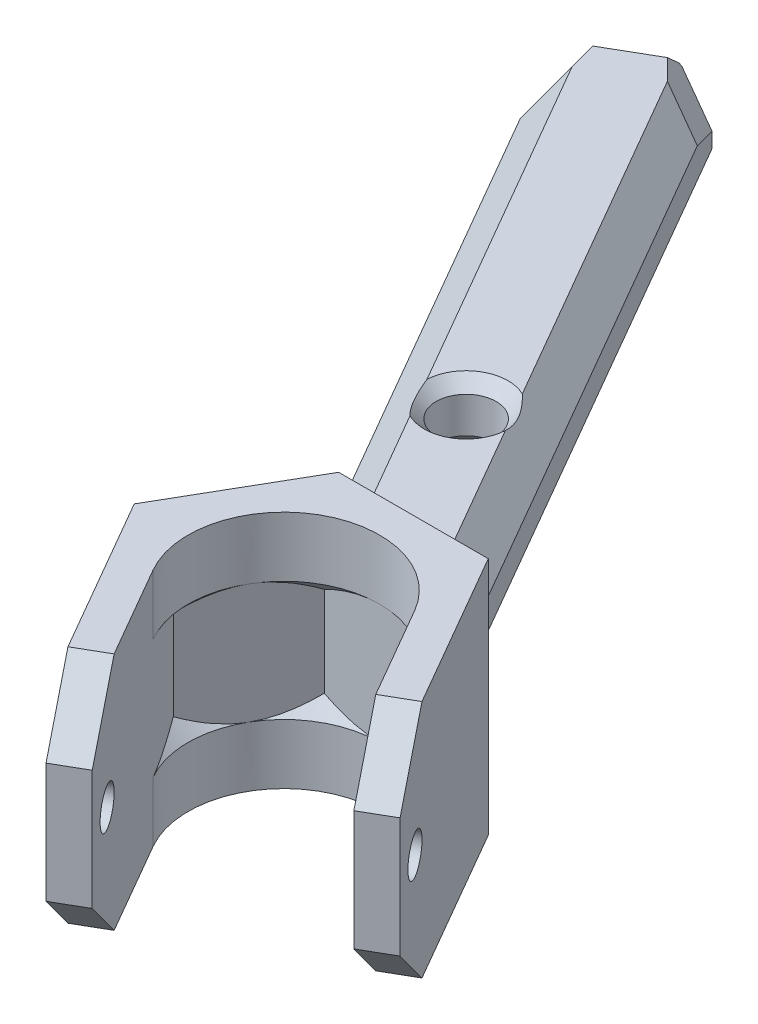
from build123d import *

# Parameters (mm, degrees)
SKETCH1_R                = 8
BOSS_EXTRUDE1_DEPTH      = 10
SKETCH1_3_R              = 8
CUT_EXTRUDE3_DEPTH       = 5
CUT_EXTRUDE6_DEPTH       = 20.324531042175384
CUT_EXTRUDE6_DEPTH_BACK  = 20.324531042175384
BOSS_EXTRUDE2_DEPTH      = 5
CHAMFER1_SIZE            = 5
CHAMFER2_SIZE            = 2.5
CHAMFER3_SIZE            = 2.5
CHAMFER4_SIZE            = 1
CHAMFER4_EDGE_2_SIZE     = 1
CHAMFER4_EDGE_2_SIZE2    = 2.7320508075695416
CHAMFER4_EDGE_3_SIZE     = 1
CHAMFER4_EDGE_3_SIZE2    = 2.7320508075682537
CUT_EXTRUDE7_DEPTH       = 0.6
SKETCH5_3_R              = 2.499999999999999
CUT_EXTRUDE8_DEPTH       = 86.3857846528101
CHAMFER5_SIZE            = 1
BOSS_EXTRUDE3_DEPTH      = 20
CHAMFER6_SIZE            = 5
CUT_EXTRUDE9_REACH       = 86.597
SKETCH7_R                = 1.6000000000000019
CHAMFER6_OF_MIRROR2_SIZE = 5


with BuildPart() as part:
    # Sketch1 → Boss-Extrude1 (new, symmetric)
    with BuildSketch(Plane(origin=(0, 0, 0), x_dir=(1, 0, 0), z_dir=(0, 1, 0))):
        Polygon((-12.5, 3.33e-15), (-6.249999999999997, -10.825317547305481), (6.249999999999998, -10.825317547305481), (12.499999999999995, 2.3e-15), (6.249999999999995, 10.825317547305485), (-6.249999999999999, 10.825317547305483), align=None)
        with Locations(Location((0, 0, 0), (0, 0, 270))):
            Circle(SKETCH1_R, mode=Mode.SUBTRACT)
    extrude(amount=BOSS_EXTRUDE1_DEPTH, both=True)

    # Sketch1<3> → Cut-Extrude3 (cut, symmetric)
    with BuildSketch(Plane(origin=(0, 0, 0), x_dir=(1, 0, 0), z_dir=(0, 1, 0))):
        with BuildLine():
            Line((9.237604307034013, 3.47e-15), (6.928203158180938, 4.000000124871458))
            ThreePointArc((6.928203158180937, 4.000000124871459), (7.727406591653098, 2.070552430458174), (8, 0))
            ThreePointArc((8, -1.96e-15), (7.727406617827326, -2.070552332774626), (6.92820325931039, -3.999999949710111))
            Line((6.92820325931039, -3.999999949710112), (9.237604307034013, 3.55e-15))
        make_face()
        with BuildLine():
            Line((6.928203158180938, 4.000000124871458), (4.6188021535170005, 7.999999999999998))
            Line((4.6188021535170005, 7.999999999999998), (-9.11633347e-09, 7.999999999999998))
            ThreePointArc((-9.11633386e-09, 8), (3.999999933616783, 6.9282032686018775), (6.928203158180937, 4.000000124871459))
        make_face()
        with BuildLine():
            ThreePointArc((-6.928203259310827, 3.9999999497093532), (-4.000000029092812, 6.928203213478766), (-9.11633386e-09, 8))
            Line((-9.11633347e-09, 7.999999999999998), (-4.618802153517008, 7.999999999999998))
            Line((-4.618802153517007, 7.999999999999998), (-6.928203259310829, 3.999999949709351))
        make_face()
        with BuildLine():
            ThreePointArc((-6.9282031729355795, -4.0000000993156695), (-7.999999999999999, -8.637524731e-08), (-6.928203259310827, 3.9999999497093532))
            Line((-6.928203259310829, 3.999999949709351), (-9.237604307034013, -1.78e-15))
            Line((-9.237604307034013, -1.73e-15), (-6.9282031729355795, -4.0000000993156695))
        make_face()
        with BuildLine():
            ThreePointArc((1.7617e-13, -8), (-3.9999999503420853, -6.928203258945519), (-6.9282031729355795, -4.0000000993156695))
            Line((-6.9282031729355795, -4.0000000993156695), (-4.6188021535170005, -8.000000000000002))
            Line((-4.6188021535170005, -8.000000000000002), (1.7586e-13, -8))
        make_face()
        with BuildLine():
            Line((4.6188021535170085, -7.999999999999998), (6.92820325931039, -3.999999949710112))
            ThreePointArc((6.92820325931039, -3.999999949710111), (4.000000025145024, -6.928203215758023), (1.7617e-13, -8))
            Line((1.7586e-13, -8), (4.618802153517008, -7.999999999999998))
        make_face()
        with Locations(Location((0, 0, 0), (0, 0, 270))):
            Circle(SKETCH1_3_R)
    extrude(amount=CUT_EXTRUDE3_DEPTH, both=True, mode=Mode.SUBTRACT)

    # Sketch2 → Revolve1 (revolve)
    with BuildSketch(Plane(origin=(0, 0, 0), x_dir=(0, 0, -1), z_dir=(1, 0, 0))):
        Polygon((9.239999999999998, 10), (8, 10), (8, 5.000000000000001), (9.24, 3.75999999999999), align=None)
    revolve1 = revolve(axis=Axis((0, 0, 0), (0, 1, 0)))

    # Mirror1: Revolve1 across plane
    add(revolve1.mirror(Plane.ZX))

    # Sketch3 → Cut-Extrude6 (cut, two sides: drawn at the far end of the back side and taken through both)
    with BuildSketch(Plane(origin=(0, 0, 0), x_dir=(1, 0, 0), z_dir=(0, 1, 0)).offset(-CUT_EXTRUDE6_DEPTH_BACK)):
        Polygon((-6.928203230275505, -4.0000000000000036), (6.928203230275509, 4), (13.370436636375942, -7.158275573583455), (-0.48596982417507123, -15.158275573583454), align=None)
    extrude(amount=CUT_EXTRUDE6_DEPTH + CUT_EXTRUDE6_DEPTH_BACK, mode=Mode.SUBTRACT)

    # Sketch4 → Boss-Extrude2 (add)
    with BuildSketch(Plane(origin=(0, -10, 0), x_dir=(-1, 0, 0), z_dir=(0, -1, 0))):
        Polygon((-6.249999999999994, 10.825317547305485), (3.55e-15, 10.825317547305483), (1.5625000000000036, 13.531646934131857), align=None)
        Polygon((1.5625000000000036, 13.531646934131857), (3.47e-15, 10.825317547305483), (6.249999999999999, 10.825317547305483), align=None)
        Polygon((35.31249999999998, 71.98836168958148), (1.5625000000000036, 13.531646934131857), (6.249999999999999, 10.825317547305485), (10.937499999999998, 8.11898816047911), (44.68750000000001, 66.57570291592872), align=None)
        Polygon((10.937499999999998, 8.11898816047911), (6.249999999999999, 10.825317547305485), (9.375, 5.412658773652744), align=None)
        Polygon((10.9375, 8.11898816047912), (9.375, 5.412658773652751), (12.500000000000002, 3.55e-15), align=None)
    extrude(amount=-BOSS_EXTRUDE2_DEPTH)

    # Chamfer1
    # the kernel refuses this chamfer: 5 mm, written as the material it adds along each edge
    with BuildSketch(Plane(origin=(19.108414939829547, -5, -10.825317547305485), x_dir=(0, 1, 3.6e-16), z_dir=(-1, 0, 0))) as chamfer1_piece_1_section:
        Polygon((CHAMFER1_SIZE, 0), (-1.78e-15, CHAMFER1_SIZE), (0, 0), align=None)
    chamfer1_piece_1 = extrude(amount=38.2168298796591, mode=Mode.PRIVATE)
    chamfer1_piece_1 = split(chamfer1_piece_1, bisect_by=Plane(origin=(0.08960373495738594, -5, -21.8058333161051), z_dir=(0.8660254037844386, 0, 0.5000000000000002)), keep=Keep.TOP, mode=Mode.PRIVATE)
    chamfer1_piece_1 = split(chamfer1_piece_1, bisect_by=Plane(origin=(4.777103734957368, -5, -2.551131165332242), z_dir=(-0.8660254037844389, 0, 0.49999999999999956)), keep=Keep.TOP, mode=Mode.PRIVATE)
    add(chamfer1_piece_1)
    with BuildSketch(Plane(origin=(19.108414939829547, -5, -10.825317547305485), x_dir=(0, 1, 3.6e-16), z_dir=(-1, 0, 0))) as chamfer1_piece_2_section:
        Polygon((CHAMFER1_SIZE, 0), (-1.78e-15, CHAMFER1_SIZE), (0, 0), align=None)
    chamfer1_piece_2 = extrude(amount=38.2168298796591, mode=Mode.PRIVATE)
    chamfer1_piece_2 = split(chamfer1_piece_2, bisect_by=Plane(origin=(17.730727624847805, -5, -6.848276836486285), z_dir=(-0.32732683535398893, 0, 0.9449111825230679)), keep=Keep.TOP, mode=Mode.PRIVATE)
    chamfer1_piece_2 = split(chamfer1_piece_2, bisect_by=Plane(origin=(4.777103734957372, -5, -2.5511311653322437), z_dir=(0.8660254037844389, 0, -0.49999999999999956)), keep=Keep.TOP, mode=Mode.PRIVATE)
    add(chamfer1_piece_2)
    with BuildSketch(Plane(origin=(19.108414939829547, -5, -10.825317547305485), x_dir=(0, 1, 3.6e-16), z_dir=(-1, 0, 0))) as chamfer1_piece_3_section:
        Polygon((CHAMFER1_SIZE, 0), (-1.78e-15, CHAMFER1_SIZE), (0, 0), align=None)
    chamfer1_piece_3 = extrude(amount=38.2168298796591, mode=Mode.PRIVATE)
    chamfer1_piece_3 = split(chamfer1_piece_3, bisect_by=Plane(origin=(17.730727624847805, -5, -6.848276836486285), z_dir=(0.32732683535398893, 0, -0.9449111825230679)), keep=Keep.TOP, mode=Mode.PRIVATE)
    chamfer1_piece_3 = split(chamfer1_piece_3, bisect_by=Plane(origin=(4.777103734957368, -5, -2.551131165332242), z_dir=(-0.8660254037844389, 0, 0.49999999999999956)), keep=Keep.TOP, mode=Mode.PRIVATE)
    add(chamfer1_piece_3)
    with BuildSketch(Plane(origin=(-18.929207469914783, -5, 11.135713990293745), x_dir=(1.5e-16, 1, 9e-17), z_dir=(0.5000000000000003, 0, -0.8660254037844386))) as chamfer1_piece_4_section:
        Polygon((CHAMFER1_SIZE, 0), (-8.9e-16, -CHAMFER1_SIZE), (0, 0), align=None)
    chamfer1_piece_4 = extrude(amount=38.216829879659116, mode=Mode.PRIVATE)
    chamfer1_piece_4 = split(chamfer1_piece_4, bisect_by=Plane(origin=(-18.929207469914786, -5, -10.825317547305481), z_dir=(1.4e-16, 0, 1)), keep=Keep.TOP, mode=Mode.PRIVATE)
    chamfer1_piece_4 = split(chamfer1_piece_4, bisect_by=Plane(origin=(-4.597896265042607, -5, 2.8615276083204897), z_dir=(0.8660254037844386, 0, -0.5000000000000002)), keep=Keep.TOP, mode=Mode.PRIVATE)
    add(chamfer1_piece_4)
    with BuildSketch(Plane(origin=(-18.929207469914783, -5, 11.135713990293745), x_dir=(1.5e-16, 1, 9e-17), z_dir=(0.5000000000000003, 0, -0.8660254037844386))) as chamfer1_piece_5_section:
        Polygon((CHAMFER1_SIZE, 0), (-8.9e-16, -CHAMFER1_SIZE), (0, 0), align=None)
    chamfer1_piece_5 = extrude(amount=38.216829879659116, mode=Mode.PRIVATE)
    chamfer1_piece_5 = split(chamfer1_piece_5, bisect_by=Plane(origin=(-14.796145524969571, -5, 11.931122132457586), z_dir=(0.9819805060619656, 0, 0.18898223650461415)), keep=Keep.TOP, mode=Mode.PRIVATE)
    chamfer1_piece_5 = split(chamfer1_piece_5, bisect_by=Plane(origin=(-4.597896265042607, -5, 2.8615276083204897), z_dir=(-0.8660254037844386, 0, 0.5000000000000002)), keep=Keep.TOP, mode=Mode.PRIVATE)
    add(chamfer1_piece_5)
    with BuildSketch(Plane(origin=(-18.929207469914783, -5, 11.135713990293745), x_dir=(1.5e-16, 1, 9e-17), z_dir=(0.5000000000000003, 0, -0.8660254037844386))) as chamfer1_piece_6_section:
        Polygon((CHAMFER1_SIZE, 0), (-8.9e-16, -CHAMFER1_SIZE), (0, 0), align=None)
    chamfer1_piece_6 = extrude(amount=38.216829879659116, mode=Mode.PRIVATE)
    chamfer1_piece_6 = split(chamfer1_piece_6, bisect_by=Plane(origin=(-14.796145524969573, -5, 11.931122132457585), z_dir=(-0.9819805060619656, 0, -0.18898223650461415)), keep=Keep.TOP, mode=Mode.PRIVATE)
    chamfer1_piece_6 = split(chamfer1_piece_6, bisect_by=Plane(origin=(-4.597896265042609, -5, 2.8615276083204915), z_dir=(0.8660254037844386, 0, -0.5000000000000002)), keep=Keep.TOP, mode=Mode.PRIVATE)
    add(chamfer1_piece_6)
    with BuildSketch(Plane(origin=(-18.929207469914783, -5, 11.135713990293745), x_dir=(1.5e-16, 1, 9e-17), z_dir=(0.5000000000000003, 0, -0.8660254037844386))) as chamfer1_piece_7a_section:
        Polygon((CHAMFER1_SIZE, 0), (-8.9e-16, -CHAMFER1_SIZE), (0, 0), align=None)
    chamfer1_piece_7a = extrude(amount=38.216829879659116, mode=Mode.PRIVATE)
    chamfer1_piece_7a = split(chamfer1_piece_7a, bisect_by=Plane(origin=(-14.796145524969571, -5, 11.931122132457586), z_dir=(0.9819805060619656, 0, 0.18898223650461415)), keep=Keep.TOP, mode=Mode.PRIVATE)
    chamfer1_piece_7a = split(chamfer1_piece_7a, bisect_by=Plane(origin=(-18.929207469914786, -5, -10.825317547305477), z_dir=(-1.4e-16, 0, -1)), keep=Keep.TOP, mode=Mode.PRIVATE)
    chamfer1_piece_7a = split(chamfer1_piece_7a, bisect_by=Plane(origin=(4.777103734957382, -5, -2.551131165332224), z_dir=(-0.8660254037844389, 0, 0.49999999999999956)), keep=Keep.TOP, mode=Mode.PRIVATE)
    with BuildSketch(Plane(origin=(19.108414939829547, -5, -10.825317547305485), x_dir=(0, 1, 3.6e-16), z_dir=(-1, 0, 0))) as chamfer1_piece_7b_section:
        Polygon((CHAMFER1_SIZE, 0), (-1.78e-15, CHAMFER1_SIZE), (0, 0), align=None)
    chamfer1_piece_7b = extrude(amount=38.2168298796591, mode=Mode.PRIVATE)
    chamfer1_piece_7b = split(chamfer1_piece_7b, bisect_by=Plane(origin=(0.08960373495739304, -5, -21.8058333161051), z_dir=(-0.8660254037844386, 0, -0.5000000000000002)), keep=Keep.TOP, mode=Mode.PRIVATE)
    chamfer1_piece_7b = split(chamfer1_piece_7b, bisect_by=Plane(origin=(-4.597896265042607, -5, 2.8615276083205003), z_dir=(0.8660254037844386, 0, -0.5000000000000002)), keep=Keep.TOP, mode=Mode.PRIVATE)
    chamfer1_piece_7b = split(chamfer1_piece_7b, bisect_by=Plane(origin=(17.730727624847805, -5, -6.848276836486287), z_dir=(-0.32732683535398893, 0, 0.9449111825230679)), keep=Keep.TOP, mode=Mode.PRIVATE)
    chamfer1_piece_7 = chamfer1_piece_7a & chamfer1_piece_7b
    add(chamfer1_piece_7)

    # Chamfer2
    chamfer2_edges = [part.edges().sort_by_distance(p)[0] for p in [
        (-28.47462567297219, -5, -38.49418084478748),
        (-19.09962567297447, -5, -43.906839618444195),
    ]]
    chamfer(chamfer2_edges, length=CHAMFER2_SIZE)

    # Chamfer3
    chamfer3_edges = [part.edges().sort_by_distance(p)[0] for p in [
        (-35.31249999999998, -8.75, -71.98836168958148),
        (-44.68750000000001, -8.75, -66.57570291592872),
    ]]
    chamfer(chamfer3_edges, length=CHAMFER3_SIZE)

    # Chamfer4
    chamfer4_edges = [part.edges().sort_by_distance(p)[0] for p in [
        (-40.00000000001547, -5, -69.28203230274616),
    ]]
    chamfer(chamfer4_edges, length=CHAMFER4_SIZE)

    # Chamfer4 edge 2
    chamfer4_edge_2_edges = [part.edges().sort_by_distance(p)[0] for p in [
        (-35.770031754746036, -6.24999999999993, -70.28082993484206),
    ]]
    chamfer4_edge_2_side = [part.faces().sort_by_distance(p)[0] for p in [
        (-35.959757505271654, -8.055555555555529, -70.33166679647876),
    ]]
    chamfer(chamfer4_edge_2_edges, length=CHAMFER4_EDGE_2_SIZE, length2=CHAMFER4_EDGE_2_SIZE2, reference=chamfer4_edge_2_side[0])

    # Chamfer4 edge 3
    chamfer4_edge_3_edges = [part.edges().sort_by_distance(p)[0] for p in [
        (-42.979968245284546, -6.250000000000065, -66.11817116118938),
    ]]
    chamfer4_edge_3_side = [part.faces().sort_by_distance(p)[0] for p in [
        (-42.929131383647835, -8.055555555555578, -66.30789691171502),
    ]]
    chamfer(chamfer4_edge_3_edges, length=CHAMFER4_EDGE_3_SIZE, length2=CHAMFER4_EDGE_3_SIZE2, reference=chamfer4_edge_3_side[0])

    # Sketch5 → Cut-Extrude7 (cut)
    with BuildSketch(Plane.XZ.offset(10)):
        Polygon((-22.33589838486227, -46.686910835277054), (-29.264101615137765, -42.68691083527706), (-41.96410161513777, -64.6839560914018), (-35.03589838486225, -68.68395609140181), align=None)
    extrude(amount=-CUT_EXTRUDE7_DEPTH, mode=Mode.SUBTRACT)

    # Sketch5<3> → Cut-Extrude8 (cut, through all)
    with BuildSketch(Plane.XZ.offset(10)):
        with Locations(Location((-20.800000000000015, -36.026656797432665, 0), (0, 0, 270))):
            Circle(SKETCH5_3_R)
    extrude(amount=-CUT_EXTRUDE8_DEPTH, mode=Mode.SUBTRACT)

    # Chamfer5
    # the kernel refuses this chamfer: 1 mm, written as the material it takes off along each edge
    with BuildSketch(Plane(origin=(-20.800000000000015, -5, -36.026656797432665), x_dir=(0, 0, -1), z_dir=(-1, 0, 0))) as chamfer5_piece_1:
        Polygon((2.5 + CHAMFER5_SIZE, 0), (2.5, CHAMFER5_SIZE), (2.5, 0), align=None)
    revolve(axis=Axis((-20.800000000000015, -5, -36.026656797432665), (0, -1, 0)), mode=Mode.SUBTRACT)
    with BuildSketch(Plane(origin=(-20.800000000000015, -10, -36.026656797432665), x_dir=(0, 0, -1), z_dir=(-1, 0, 0))) as chamfer5_piece_2:
        Polygon((2.5 + CHAMFER5_SIZE, 0), (2.5, -CHAMFER5_SIZE), (2.5, 0), align=None)
    revolve(axis=Axis((-20.800000000000015, -10, -36.026656797432665), (0, -1, 0)), mode=Mode.SUBTRACT)

    # Sketch6 → Boss-Extrude3 (add)
    with BuildSketch(Plane(origin=(0, -10, 0), x_dir=(-1, 0, 0), z_dir=(0, -1, 0))):
        Polygon((-10.868802153517006, -2.8253175473054815), (-13.868802153517004, -8.021469970012113), (-16.315598923241495, -6.608811196359374), (-12.499999999999995, 1.73e-15), align=None)
    boss_extrude3 = extrude(amount=-BOSS_EXTRUDE3_DEPTH)

    # Chamfer6
    chamfer6_edges = [part.edges().sort_by_distance(p)[0] for p in [
        (15.092200538379249, -10, 7.315140583185744),
        (15.092200538379249, 10, 7.315140583185744),
    ]]
    chamfer(chamfer6_edges, length=CHAMFER6_SIZE)

    # Sketch7 → Cut-Extrude9 (cut, up to next)
    with BuildSketch(Plane(origin=(9.374999999999996, 0, -5.4126587736527405), x_dir=(-0.5000000000000001, 0, -0.8660254037844386), z_dir=(0.8660254037844386, 0, -0.5000000000000001)), mode=Mode.PRIVATE) as cut_extrude9_sk1:
        with Locations((-10.481197846482983, 0)):
            Circle(SKETCH7_R)
    cut_extrude9_tool1 = extrude(cut_extrude9_sk1.sketch, amount=-CUT_EXTRUDE9_REACH, mode=Mode.PRIVATE) & part.part
    cut_extrude9 = cut_extrude9_tool1.solids().sort_by_distance((14.615599, 0, 3.664325))[0]
    add(cut_extrude9, mode=Mode.SUBTRACT)

    # Mirror2: Boss-Extrude3, Cut-Extrude9 across plane
    add(boss_extrude3.mirror(Plane(origin=(0, 0, 0), x_dir=(0.5000000000000001, 0, 0.8660254037844386), z_dir=(0.8660254037844386, 0, -0.5000000000000001))))
    add(cut_extrude9.mirror(Plane(origin=(0, 0, 0), x_dir=(0.5000000000000001, 0, 0.8660254037844386), z_dir=(0.8660254037844386, 0, -0.5000000000000001))), mode=Mode.SUBTRACT)

    # Chamfer6 of Mirror2
    chamfer6_of_mirror2_edges = [part.edges().sort_by_distance(p)[0] for p in [
        (-1.211002691896252, -10, 16.727799356838485),
        (-1.211002691896252, 10, 16.727799356838485),
    ]]
    chamfer(chamfer6_of_mirror2_edges, length=CHAMFER6_OF_MIRROR2_SIZE)


solid = part.part
